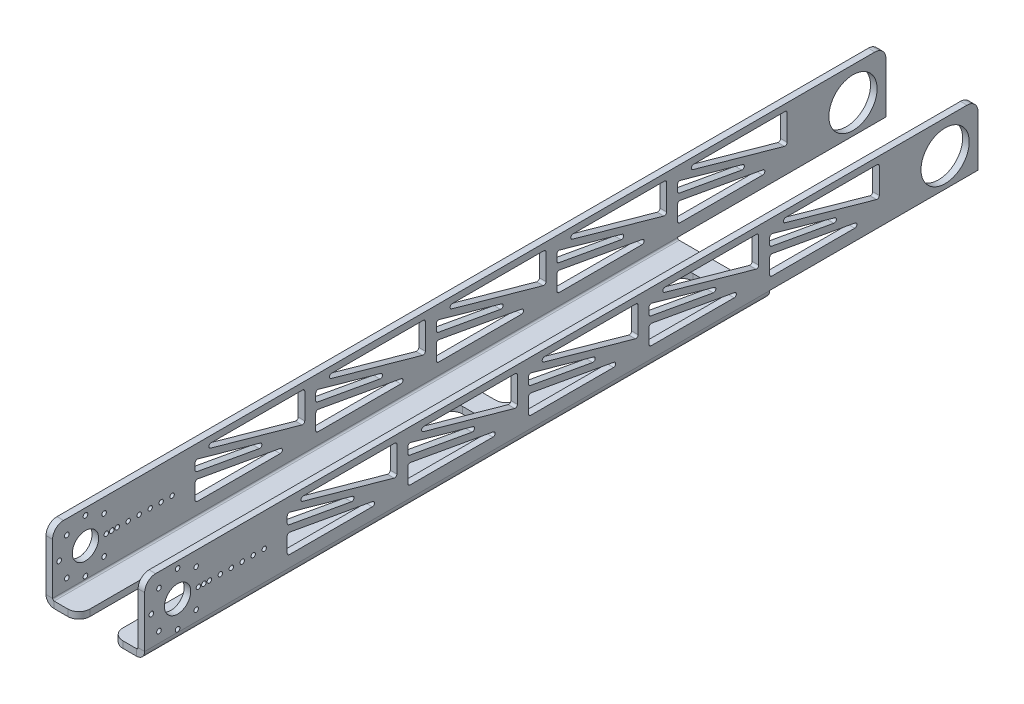
from build123d import *

# Parameters (mm, degrees)
SKETCH1_W                      = 45
SKETCH1_H                      = 380
BASE_FLANGE1_DEPTH             = 3
EDGE_FLANGE1_STRIP_W           = 13.4732
EDGE_FLANGE1_STRIP_H           = 3
EDGE_FLANGE1_STRIP_CUT_DEPTH   = 380
EDGE_FLANGE1_STRIP_2_W         = 13.4732
EDGE_FLANGE1_STRIP_2_H         = 3
EDGE_FLANGE1_STRIP_CUT_2_DEPTH = 380
EDGE_FLANGE1_DEPTH             = 380
EDGE_FLANGE1_BEND_DEPTH        = 380
SKETCH12_W                     = 15
SKETCH12_H                     = 95
CUT_EXTRUDE1_DEPTH             = 194.512919465
LPATTERN1_COUNT                = 4
LPATTERN1_PITCH                = 105
CUT_EXTRUDE2_DEPTH             = 194.512919465
CUT_EXTRUDE2_DEPTH_BACK        = 194.512919465
SKETCH14_R                     = 1
SKETCH14_R_2                   = 6
SKETCH14_R_3                   = 11
SKETCH14_R_4                   = 1.05
FILLET1_R                      = 5
CUT_EXTRUDE3_DEPTH             = 194.512919465
LPATTERN2_COUNT                = 5
LPATTERN2_PITCH                = 55
FILLET2_R                      = 1
CUT_EXTRUDE6_DEPTH             = 194.512919465
CUT_EXTRUDE6_DEPTH_BACK        = 194.512919465
SKETCH19_W                     = 95
SKETCH19_H                     = 3.8


# Sheet-metal steps are written as plain solids
with BuildPart() as part:
    # Sketch1 → Base-Flange1 (new body)
    with BuildSketch(Plane(origin=(0, 0, 0), x_dir=(1, 0, 0), z_dir=(0, 1, 0))):
        Rectangle(SKETCH1_W, SKETCH1_H)
    extrude(amount=-BASE_FLANGE1_DEPTH)

    # Edge-Flange1 strip (across the edge) → Edge-Flange1 strip cut (cut)
    with BuildSketch(Plane(origin=(-22.5, 0, -190), x_dir=(1, 0, 0), z_dir=(0, 0, 1))):
        with Locations((-3, -1.5)):
            Rectangle(EDGE_FLANGE1_STRIP_W, EDGE_FLANGE1_STRIP_H)
    extrude(amount=EDGE_FLANGE1_STRIP_CUT_DEPTH, mode=Mode.SUBTRACT)

    # Edge-Flange1 strip 2 (across the edge) → Edge-Flange1 strip cut 2 (cut)
    with BuildSketch(Plane(origin=(22.5, 0, 190), x_dir=(-1, 0, 0), z_dir=(0, 0, -1))):
        with Locations((-3, -1.5)):
            Rectangle(EDGE_FLANGE1_STRIP_2_W, EDGE_FLANGE1_STRIP_2_H)
    extrude(amount=EDGE_FLANGE1_STRIP_CUT_2_DEPTH, mode=Mode.SUBTRACT)

    # Edge-Flange1 section (across the edge) → Edge-Flange1 (add)
    with BuildSketch(Plane(origin=(-22.5, 0, -190), x_dir=(1, 0, 0), z_dir=(0, 0, 1))):
        with BuildLine():
            Line((0, 0.7366), (0, 29))
            Line((0, 29), (3, 29))
            Line((3, 29), (3, 0.7366))
            ThreePointArc((3, 0.7366), (3.215745145, 0.215745145), (3.7366, 0))
            Line((3.7366, 0), (3.7366, -3))
            ThreePointArc((3.7366, -3), (1.094424801, -1.905575199), (0, 0.7366))
        make_face()
    extrude(amount=EDGE_FLANGE1_DEPTH)

    # Edge-Flange1 section 2 (across the edge) → Edge-Flange1 bend (add)
    with BuildSketch(Plane(origin=(22.5, 0, 190), x_dir=(-1, 0, 0), z_dir=(0, 0, -1))):
        with BuildLine():
            Line((0, 0.7366), (0, 29))
            Line((0, 29), (3, 29))
            Line((3, 29), (3, 0.7366))
            ThreePointArc((3, 0.7366), (3.215745145, 0.215745145), (3.7366, 0))
            Line((3.7366, 0), (3.7366, -3))
            ThreePointArc((3.7366, -3), (1.094424801, -1.905575199), (0, 0.7366))
        make_face()
    extrude(amount=EDGE_FLANGE1_BEND_DEPTH)

    # Sketch12 → Cut-Extrude1 (cut, symmetric)
    with BuildSketch(Plane(origin=(0, 0, 0), x_dir=(1, 0, 0), z_dir=(0, 1, 0))):
        with Locations((0, 37.5)):
            Rectangle(SKETCH12_W, SKETCH12_H)
        with Locations((0, -67.5)):
            Rectangle(SKETCH12_W, SKETCH12_H)
    cut_extrude1 = extrude(amount=CUT_EXTRUDE1_DEPTH, both=True, mode=Mode.SUBTRACT)

    # LPattern1: Cut-Extrude1 ×4
    with Locations(*[(0, 0, i * LPATTERN1_PITCH) for i in range(1, LPATTERN1_COUNT)]):
        add(cut_extrude1, mode=Mode.SUBTRACT)

    # Sketch14 → Cut-Extrude2 (cut, two sides: drawn at the far end of the back side and taken through both)
    with BuildSketch(Plane(origin=(0, 0, 0), x_dir=(0, 0, -1), z_dir=(1, 0, 0)).offset(-CUT_EXTRUDE2_DEPTH_BACK)):
        with Locations((-165.5, 14)):
            Circle(SKETCH14_R)
        with Locations((-175, 14)):
            Circle(SKETCH14_R_2)
        with Locations((-160.5, 14)):
            Circle(SKETCH14_R)
        with Locations((-155.5, 14)):
            Circle(SKETCH14_R)
        with Locations((-150.5, 14)):
            Circle(SKETCH14_R)
        with Locations((-145.5, 14)):
            Circle(SKETCH14_R)
        with Locations((-140.5, 14)):
            Circle(SKETCH14_R)
        with Locations((-135.5, 14)):
            Circle(SKETCH14_R)
        with Locations((175, 14)):
            Circle(SKETCH14_R_3)
        with Locations((-175, 26)):
            Circle(SKETCH14_R_4)
        with Locations((-166.514718626, 22.485281374)):
            Circle(SKETCH14_R_4)
        with Locations((-163, 14)):
            Circle(SKETCH14_R_4)
        with Locations((-166.514718626, 5.514718626)):
            Circle(SKETCH14_R_4)
        with Locations((-175, 2)):
            Circle(SKETCH14_R_4)
        with Locations((-183.485281374, 5.514718626)):
            Circle(SKETCH14_R_4)
        with Locations((-187, 14)):
            Circle(SKETCH14_R_4)
        with Locations((-183.485281374, 22.485281374)):
            Circle(SKETCH14_R_4)
    extrude(amount=CUT_EXTRUDE2_DEPTH + CUT_EXTRUDE2_DEPTH_BACK, mode=Mode.SUBTRACT)

    # Fillet1
    fillet1_edges = [part.edges().sort_by_distance(p)[0] for p in [
        (7.5, -1.5, 20),
        (7.5, -1.5, 115),
        (-7.5, -1.5, 115),
        (-7.5, -1.5, 20),
        (-7.5, -1.5, 190),
        (7.5, -1.5, 190),
        (-7.5, -1.5, 125),
        (7.5, -1.5, 125),
        (-21, 29, -190),
        (-21, 29, 190),
        (21, 29, 190),
        (21, 29, -190),
        (7.5, -1.5, -85),
        (7.5, -1.5, 10),
        (-7.5, -1.5, 10),
        (-7.5, -1.5, -85),
    ]]
    fillet(fillet1_edges, radius=FILLET1_R)

    # Sketch16 → Cut-Extrude3 (cut, symmetric)
    with BuildSketch(Plane(origin=(0, 0, 0), x_dir=(0, 0, -1), z_dir=(1, 0, 0))):
        Polygon((-125, 26), (-75, 12), (-75, 26), align=None)
        Polygon((-75, 6), (-125, 15), (-125, 6), align=None)
        Polygon((-125, 23), (-125, 18), (-75, 9), align=None)
    cut_extrude3 = extrude(amount=CUT_EXTRUDE3_DEPTH, both=True, mode=Mode.SUBTRACT)

    # LPattern2: Cut-Extrude3 ×5
    with Locations(*[(0, 0, -i * LPATTERN2_PITCH) for i in range(1, LPATTERN2_COUNT)]):
        add(cut_extrude3, mode=Mode.SUBTRACT)

    # Fillet2
    fillet2_edges = [part.edges().sort_by_distance(p)[0] for p in [
        (21, 26, 125),
        (21, 26, 75),
        (21, 12, 75),
        (-21, 26, 125),
        (-21, 26, 75),
        (-21, 12, 75),
        (21, 23, 125),
        (21, 9, 75),
        (21, 18, 125),
        (-21, 23, 125),
        (-21, 9, 75),
        (-21, 18, 125),
        (21, 6, 75),
        (21, 6, 125),
        (21, 15, 125),
        (-21, 6, 75),
        (-21, 6, 125),
        (-21, 15, 125),
        (-21, 26, 70),
        (-21, 26, 20),
        (-21, 12, 20),
        (-21, 26, 15),
        (-21, 26, -35),
        (-21, 12, -35),
        (-21, 26, -40),
        (-21, 26, -90),
        (-21, 12, -90),
        (-21, 26, -95),
        (-21, 26, -145),
        (-21, 12, -145),
        (21, 15, 70),
        (21, 6, 70),
        (21, 6, 20),
        (21, 15, 15),
        (21, 6, 15),
        (21, 6, -35),
        (21, 15, -40),
        (21, 6, -40),
        (21, 6, -90),
        (21, 15, -95),
        (21, 6, -95),
        (21, 6, -145),
        (21, 18, 70),
        (21, 9, 20),
        (21, 23, 70),
        (21, 18, 15),
        (21, 9, -35),
        (21, 23, 15),
        (21, 18, -40),
        (21, 9, -90),
        (21, 23, -40),
        (21, 18, -95),
        (21, 9, -145),
        (21, 23, -95),
        (21, 12, 20),
        (21, 26, 20),
        (21, 26, 70),
        (21, 12, -35),
        (21, 26, -35),
        (21, 26, 15),
        (21, 12, -90),
        (21, 26, -90),
        (21, 26, -40),
        (21, 12, -145),
        (21, 26, -145),
        (21, 26, -95),
        (-21, 6, 20),
        (-21, 6, 70),
        (-21, 15, 70),
        (-21, 6, -35),
        (-21, 6, 15),
        (-21, 15, 15),
        (-21, 6, -90),
        (-21, 6, -40),
        (-21, 15, -40),
        (-21, 6, -145),
        (-21, 6, -95),
        (-21, 15, -95),
        (-21, 23, 70),
        (-21, 9, 20),
        (-21, 18, 70),
        (-21, 23, 15),
        (-21, 9, -35),
        (-21, 18, 15),
        (-21, 23, -40),
        (-21, 9, -90),
        (-21, 18, -40),
        (-21, 23, -95),
        (-21, 9, -145),
        (-21, 18, -95),
    ]]
    fillet(fillet2_edges, radius=FILLET2_R)

    # Sketch19 → Cut-Extrude6 (cut, two sides: drawn at the far end of the back side and taken through both)
    with BuildSketch(Plane(origin=(0, 0, 0), x_dir=(0, 0, -1), z_dir=(1, 0, 0)).offset(-CUT_EXTRUDE6_DEPTH_BACK)):
        with Locations((142.5, -1.1)):
            Rectangle(SKETCH19_W, SKETCH19_H)
    extrude(amount=CUT_EXTRUDE6_DEPTH + CUT_EXTRUDE6_DEPTH_BACK, mode=Mode.SUBTRACT)


solid = part.part
